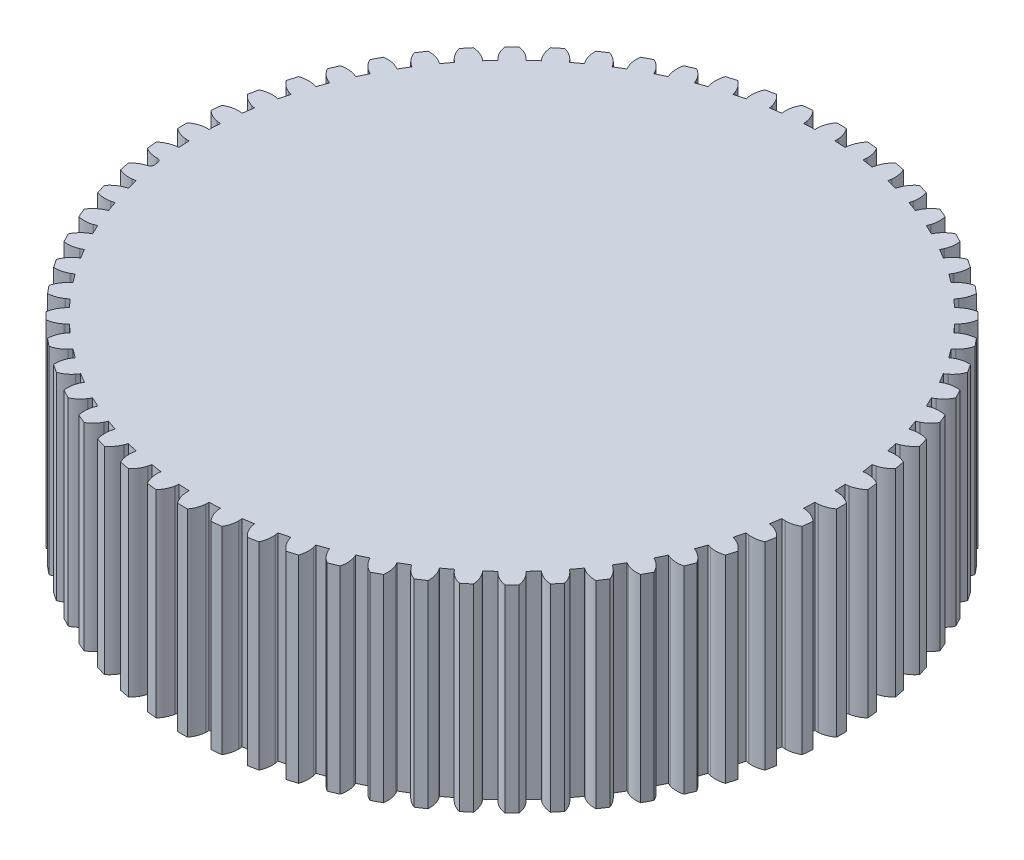
from build123d import *

# Parameters (mm, degrees)
SKETCH2_R           = 47.5
BOSS_EXTRUDE1_DEPTH = 30
BOSS_EXTRUDE2_DEPTH = 30


with BuildPart() as part:
    # Sketch2 → Boss-Extrude1 (new body)
    with BuildSketch(Plane(origin=(0, 0, 0), x_dir=(1, 0, 0), z_dir=(0, 1, 0))):
        Circle(SKETCH2_R)
    extrude(amount=BOSS_EXTRUDE1_DEPTH)

    # Sketch3 → Boss-Extrude2 (add)
    with BuildSketch(Plane(origin=(0, 30, 0), x_dir=(1, 0, 0), z_dir=(0, 1, 0))):
        with BuildLine():
            ThreePointArc((-1.507440184, 47.476074228), (0, 47.5), (1.507440184, 47.476074228))
            ThreePointArc((1.507440184, 47.476074228), (1.514413482, 47.721045398), (1.505602789, 47.965957367))
            ThreePointArc((1.505602789, 47.965957367), (1.501707512, 48.00187307), (1.5, 48.037959013))
            ThreePointArc((1.5, 48.037959013), (1.262315389, 49.068807268), (0.75, 49.994374684))
            Line((0.75, 49.994374684), (-0.75, 49.994374684))
            ThreePointArc((-0.75, 49.994374684), (-1.262315389, 49.068807268), (-1.5, 48.037959013))
            ThreePointArc((-1.5, 48.037959013), (-1.501707512, 48.00187307), (-1.505602789, 47.965957367))
            ThreePointArc((-1.505602789, 47.965957367), (-1.514413482, 47.721045398), (-1.507440184, 47.476074228))
        make_face()
        with BuildLine():
            ThreePointArc((-3.21576628, 47.953668821), (-3.553347172, 48.956256094), (-4.153917094, 49.82715096))
            Line((-4.153917094, 49.82715096), (-5.646694184, 49.680125249))
            ThreePointArc((-5.646694184, 49.680125249), (-6.065821164, 48.708799004), (-6.20132046, 47.6596174))
            ThreePointArc((-6.20132046, 47.6596174), (-6.199482709, 47.623537855), (-6.199838874, 47.587413292))
            ThreePointArc((-6.199838874, 47.587413292), (-6.184601571, 47.342817042), (-6.153650477, 47.099708978))
            ThreePointArc((-6.153650477, 47.099708978), (-4.655814166, 47.271274517), (-3.153287582, 47.39521893))
            ThreePointArc((-3.153287582, 47.39521893), (-3.170359236, 47.639694), (-3.203133074, 47.882563052))
            ThreePointArc((-3.203133074, 47.882563052), (-3.210529949, 47.917924007), (-3.21576628, 47.953668821))
        make_face()
        with BuildLine():
            Line((5.646694184, 49.680125249), (4.153917094, 49.82715096))
            ThreePointArc((4.153917094, 49.82715096), (3.553347172, 48.956256094), (3.21576628, 47.953668821))
            ThreePointArc((3.21576628, 47.953668821), (3.210529949, 47.917924007), (3.203133074, 47.882563052))
            ThreePointArc((3.203133074, 47.882563052), (3.170359236, 47.639694), (3.153287582, 47.39521893))
            ThreePointArc((3.153287582, 47.39521893), (4.655814166, 47.271274517), (6.153650477, 47.099708978))
            ThreePointArc((6.153650477, 47.099708978), (6.184601571, 47.342817042), (6.199838874, 47.587413292))
            ThreePointArc((6.199838874, 47.587413292), (6.199482709, 47.623537855), (6.20132046, 47.6596174))
            ThreePointArc((6.20132046, 47.6596174), (6.065821164, 48.708799004), (5.646694184, 49.680125249))
        make_face()
        with BuildLine():
            ThreePointArc((-7.900562972, 47.407558583), (-8.334789058, 48.372229411), (-9.017829696, 49.180064534))
            Line((-9.017829696, 49.180064534), (-10.489007616, 48.887429051))
            ThreePointArc((-10.489007616, 48.887429051), (-10.810909764, 47.879698379), (-10.842918813, 46.822287617))
            ThreePointArc((-10.842918813, 46.822287617), (-10.837553498, 46.786561936), (-10.834367122, 46.750576413))
            ThreePointArc((-10.834367122, 46.750576413), (-10.795228566, 46.508651478), (-10.740597753, 46.269747783))
            ThreePointArc((-10.740597753, 46.269747783), (-9.266790296, 46.587300819), (-7.783647466, 46.857921765))
            ThreePointArc((-7.783647466, 46.857921765), (-7.824599662, 47.099546306), (-7.881021015, 47.338033479))
            ThreePointArc((-7.881021015, 47.338033479), (-7.891848251, 47.372499141), (-7.900562972, 47.407558583))
        make_face()
        with BuildLine():
            Line((10.489007616, 48.887429051), (9.017829696, 49.180064534))
            ThreePointArc((9.017829696, 49.180064534), (8.334789058, 48.372229411), (7.900562972, 47.407558583))
            ThreePointArc((7.900562972, 47.407558583), (7.891848251, 47.372499141), (7.881021015, 47.338033479))
            ThreePointArc((7.881021015, 47.338033479), (7.824599662, 47.099546306), (7.783647466, 46.857921765))
            ThreePointArc((7.783647466, 46.857921765), (9.266790296, 46.587300819), (10.740597753, 46.269747783))
            ThreePointArc((10.740597753, 46.269747783), (10.795228566, 46.508651478), (10.834367122, 46.750576413))
            ThreePointArc((10.834367122, 46.750576413), (10.837553498, 46.786561936), (10.842918813, 46.822287617))
            ThreePointArc((10.842918813, 46.822287617), (10.810909764, 47.879698379), (10.489007616, 48.887429051))
        make_face()
        with BuildLine():
            ThreePointArc((-12.509272924, 46.404887641), (-13.035962369, 47.322351716), (-13.794895668, 48.059347202))
            Line((-13.794895668, 48.059347202), (-15.230306171, 47.623920186))
            ThreePointArc((-15.230306171, 47.623920186), (-15.451883394, 46.589490086), (-15.380093932, 45.53403361))
            ThreePointArc((-15.380093932, 45.53403361), (-15.371252722, 45.499005851), (-15.364554492, 45.463505927))
            ThreePointArc((-15.364554492, 45.463505927), (-15.301891608, 45.226582175), (-15.2241072, 44.994183624))
            ThreePointArc((-15.2241072, 44.994183624), (-13.78852217, 45.454665947), (-12.339046569, 45.869357198))
            ThreePointArc((-12.339046569, 45.869357198), (-12.403484915, 46.105804233), (-12.483010415, 46.337612766))
            ThreePointArc((-12.483010415, 46.337612766), (-12.497163741, 46.370851212), (-12.509272924, 46.404887641))
        make_face()
        with BuildLine():
            Line((15.230306171, 47.623920186), (13.794895668, 48.059347202))
            ThreePointArc((13.794895668, 48.059347202), (13.035962369, 47.322351716), (12.509272924, 46.404887641))
            ThreePointArc((12.509272924, 46.404887641), (12.497163741, 46.370851212), (12.483010415, 46.337612766))
            ThreePointArc((12.483010415, 46.337612766), (12.403484915, 46.105804233), (12.339046569, 45.869357198))
            ThreePointArc((12.339046569, 45.869357198), (13.78852217, 45.454665947), (15.2241072, 44.994183624))
            ThreePointArc((15.2241072, 44.994183624), (15.301891608, 45.226582175), (15.364554492, 45.463505927))
            ThreePointArc((15.364554492, 45.463505927), (15.371252722, 45.499005851), (15.380093932, 45.53403361))
            ThreePointArc((15.380093932, 45.53403361), (15.451883394, 46.589490086), (15.230306171, 47.623920186))
        make_face()
        with BuildLine():
            ThreePointArc((-16.99751174, 44.955312264), (-17.611592236, 45.816733905), (-18.439109253, 46.475792085))
            Line((-18.439109253, 46.475792085), (-19.824928552, 45.901766937))
            ThreePointArc((-19.824928552, 45.901766937), (-19.944046939, 44.850599534), (-19.769150338, 43.807261967))
            ThreePointArc((-19.769150338, 43.807261967), (-19.756918381, 43.773269466), (-19.746772803, 43.738597026))
            ThreePointArc((-19.746772803, 43.738597026), (-19.661189069, 43.508956164), (-19.561000173, 43.285300879))
            ThreePointArc((-19.561000173, 43.285300879), (-18.177463037, 43.884277794), (-16.775613908, 44.439045647))
            ThreePointArc((-16.775613908, 44.439045647), (-16.862917829, 44.668038063), (-16.964781601, 44.890935512))
            ThreePointArc((-16.964781601, 44.890935512), (-16.982124712, 44.922626636), (-16.99751174, 44.955312264))
        make_face()
        with BuildLine():
            Line((19.824928552, 45.901766937), (18.439109253, 46.475792085))
            ThreePointArc((18.439109253, 46.475792085), (17.611592236, 45.816733905), (16.99751174, 44.955312264))
            ThreePointArc((16.99751174, 44.955312264), (16.982124712, 44.922626636), (16.964781601, 44.890935512))
            ThreePointArc((16.964781601, 44.890935512), (16.862917829, 44.668038063), (16.775613908, 44.439045647))
            ThreePointArc((16.775613908, 44.439045647), (18.177463037, 43.884277794), (19.561000173, 43.285300879))
            ThreePointArc((19.561000173, 43.285300879), (19.661189069, 43.508956164), (19.746772803, 43.738597026))
            ThreePointArc((19.746772803, 43.738597026), (19.756918381, 43.773269466), (19.769150338, 43.807261967))
            ThreePointArc((19.769150338, 43.807261967), (19.944046939, 44.850599534), (19.824928552, 45.901766937))
        make_face()
        with BuildLine():
            ThreePointArc((-21.322055226, 43.072792655), (-22.017612842, 43.869875901), (-22.905744137, 44.444649684))
            Line((-22.905744137, 44.444649684), (-24.228626034, 43.737554579))
            ThreePointArc((-24.228626034, 43.737554579), (-24.24413841, 42.67977319), (-23.967819019, 41.658602444))
            ThreePointArc((-23.967819019, 41.658602444), (-23.952314114, 41.625972568), (-23.938818897, 41.592461525))
            ThreePointArc((-23.938818897, 41.592461525), (-23.831138532, 41.372315119), (-23.709510021, 41.159557026))
            ThreePointArc((-23.709510021, 41.159557026), (-22.391344999, 41.891260057), (-21.050622915, 42.580761793))
            ThreePointArc((-21.050622915, 42.580761793), (-21.159951625, 42.800094267), (-21.283172666, 43.011934008))
            ThreePointArc((-21.283172666, 43.011934008), (-21.303538539, 43.04177261), (-21.322055226, 43.072792655))
        make_face()
        with BuildLine():
            Line((24.228626034, 43.737554579), (22.905744137, 44.444649684))
            ThreePointArc((22.905744137, 44.444649684), (22.017612842, 43.869875901), (21.322055226, 43.072792655))
            ThreePointArc((21.322055226, 43.072792655), (21.303538539, 43.04177261), (21.283172666, 43.011934008))
            ThreePointArc((21.283172666, 43.011934008), (21.159951625, 42.800094267), (21.050622915, 42.580761793))
            ThreePointArc((21.050622915, 42.580761793), (22.391344999, 41.891260057), (23.709510021, 41.159557026))
            ThreePointArc((23.709510021, 41.159557026), (23.831138532, 41.372315119), (23.938818897, 41.592461525))
            ThreePointArc((23.938818897, 41.592461525), (23.952314114, 41.625972568), (23.967819019, 41.658602444))
            ThreePointArc((23.967819019, 41.658602444), (24.24413841, 42.67977319), (24.228626034, 43.737554579))
        make_face()
        with BuildLine():
            ThreePointArc((-25.441255664, 40.775458506), (-26.2115918, 41.50052701), (-27.151784183, 41.98548101))
            Line((-27.151784183, 41.98548101), (-28.398988602, 41.152125661))
            ThreePointArc((-28.398988602, 41.152125661), (-28.310745575, 40.0979173), (-27.935664501, 39.108747807))
            ThreePointArc((-27.935664501, 39.108747807), (-27.91703597, 39.077794799), (-27.900321079, 39.045767883))
            ThreePointArc((-27.900321079, 39.045767883), (-27.771581103, 38.837236064), (-27.629684327, 38.637424138))
            ThreePointArc((-27.629684327, 38.637424138), (-26.389586068, 39.494806584), (-25.122902916, 40.312401926))
            ThreePointArc((-25.122902916, 40.312401926), (-25.25320352, 40.519962167), (-25.396595144, 40.718704068))
            ThreePointArc((-25.396595144, 40.718704068), (-25.419787644, 40.746402784), (-25.441255664, 40.775458506))
        make_face()
        with BuildLine():
            Line((28.398988602, 41.152125661), (27.151784183, 41.98548101))
            ThreePointArc((27.151784183, 41.98548101), (26.2115918, 41.50052701), (25.441255664, 40.775458506))
            ThreePointArc((25.441255664, 40.775458506), (25.419787644, 40.746402784), (25.396595144, 40.718704068))
            ThreePointArc((25.396595144, 40.718704068), (25.25320352, 40.519962167), (25.122902916, 40.312401926))
            ThreePointArc((25.122902916, 40.312401926), (26.389586068, 39.494806584), (27.629684327, 38.637424138))
            ThreePointArc((27.629684327, 38.637424138), (27.771581103, 38.837236064), (27.900321079, 39.045767883))
            ThreePointArc((27.900321079, 39.045767883), (27.91703597, 39.077794799), (27.935664501, 39.108747807))
            ThreePointArc((27.935664501, 39.108747807), (28.310745575, 40.0979173), (28.398988602, 41.152125661))
        make_face()
        with BuildLine():
            ThreePointArc((-29.315442903, 38.085434401), (-30.153138801, 38.731505358), (-31.136337705, 39.121969203))
            Line((-31.136337705, 39.121969203), (-32.295853385, 38.170379277))
            ThreePointArc((-32.295853385, 38.170379277), (-32.104704784, 37.129896547), (-31.634474263, 36.182254549))
            ThreePointArc((-31.634474263, 36.182254549), (-31.612901507, 36.153276503), (-31.593127916, 36.123042152))
            ThreePointArc((-31.593127916, 36.123042152), (-31.444568166, 35.928133195), (-31.283769669, 35.743191734))
            ThreePointArc((-31.283769669, 35.743191734), (-30.133680998, 36.717996535), (-28.953235629, 37.655811592))
            ThreePointArc((-28.953235629, 37.655811592), (-29.103253261, 37.849600681), (-29.265434528, 38.033330748))
            ThreePointArc((-29.265434528, 38.033330748), (-29.291230298, 38.058622824), (-29.315442903, 38.085434401))
        make_face()
        with BuildLine():
            Line((32.295853385, 38.170379277), (31.136337705, 39.121969203))
            ThreePointArc((31.136337705, 39.121969203), (30.153138801, 38.731505358), (29.315442903, 38.085434401))
            ThreePointArc((29.315442903, 38.085434401), (29.291230298, 38.058622824), (29.265434528, 38.033330748))
            ThreePointArc((29.265434528, 38.033330748), (29.103253261, 37.849600681), (28.953235629, 37.655811592))
            ThreePointArc((28.953235629, 37.655811592), (30.133680998, 36.717996535), (31.283769669, 35.743191734))
            ThreePointArc((31.283769669, 35.743191734), (31.444568166, 35.928133195), (31.593127917, 36.123042152))
            ThreePointArc((31.593127917, 36.123042152), (31.612901507, 36.153276503), (31.634474263, 36.182254549))
            ThreePointArc((31.634474263, 36.182254549), (32.104704784, 37.129896547), (32.295853385, 38.170379277))
        make_face()
        with BuildLine():
            ThreePointArc((-32.907306401, 35.028626744), (-33.804294592, 35.589478136), (-34.821031274, 35.881691446))
            Line((-34.821031274, 35.881691446), (-35.881691446, 34.821031274))
            ThreePointArc((-35.881691446, 34.821031274), (-35.589478136, 33.804294592), (-35.028626744, 32.907306401))
            ThreePointArc((-35.028626744, 32.907306401), (-35.004317522, 32.880582392), (-34.981675662, 32.852431778))
            ThreePointArc((-34.981675662, 32.852431778), (-34.814726849, 32.673022763), (-34.636575207, 32.504732854))
            ThreePointArc((-34.636575207, 32.504732854), (-33.587572106, 33.587572106), (-32.504732854, 34.636575207))
            ThreePointArc((-32.504732854, 34.636575207), (-32.673022763, 34.814726849), (-32.852431778, 34.981675662))
            ThreePointArc((-32.852431778, 34.981675662), (-32.880582392, 35.004317522), (-32.907306401, 35.028626744))
        make_face()
        with BuildLine():
            Line((35.881691446, 34.821031274), (34.821031274, 35.881691446))
            ThreePointArc((34.821031274, 35.881691446), (33.804294592, 35.589478136), (32.907306401, 35.028626744))
            ThreePointArc((32.907306401, 35.028626744), (32.880582392, 35.004317522), (32.852431778, 34.981675662))
            ThreePointArc((32.852431778, 34.981675662), (32.673022763, 34.814726849), (32.504732854, 34.636575207))
            ThreePointArc((32.504732854, 34.636575207), (33.587572106, 33.587572106), (34.636575207, 32.504732854))
            ThreePointArc((34.636575207, 32.504732854), (34.814726849, 32.673022763), (34.981675662, 32.852431778))
            ThreePointArc((34.981675662, 32.852431778), (35.004317522, 32.880582392), (35.028626744, 32.907306401))
            ThreePointArc((35.028626744, 32.907306401), (35.589478136, 33.804294592), (35.881691446, 34.821031274))
        make_face()
        with BuildLine():
            ThreePointArc((-36.182254549, 31.634474263), (-37.129896547, 32.104704784), (-38.170379277, 32.295853385))
            Line((-38.170379277, 32.295853385), (-39.121969203, 31.136337705))
            ThreePointArc((-39.121969203, 31.136337705), (-38.731505358, 30.153138801), (-38.085434401, 29.315442903))
            ThreePointArc((-38.085434401, 29.315442903), (-38.058622824, 29.291230298), (-38.033330748, 29.265434528))
            ThreePointArc((-38.033330748, 29.265434528), (-37.849600681, 29.103253261), (-37.655811592, 28.953235629))
            ThreePointArc((-37.655811592, 28.953235629), (-36.717996535, 30.133680998), (-35.743191734, 31.283769669))
            ThreePointArc((-35.743191734, 31.283769669), (-35.928133195, 31.444568166), (-36.123042152, 31.593127916))
            ThreePointArc((-36.123042152, 31.593127916), (-36.153276503, 31.612901507), (-36.182254549, 31.634474263))
        make_face()
        with BuildLine():
            Line((39.121969203, 31.136337705), (38.170379277, 32.295853385))
            ThreePointArc((38.170379277, 32.295853385), (37.129896547, 32.104704784), (36.182254549, 31.634474263))
            ThreePointArc((36.182254549, 31.634474263), (36.153276503, 31.612901507), (36.123042152, 31.593127917))
            ThreePointArc((36.123042152, 31.593127917), (35.928133195, 31.444568166), (35.743191734, 31.283769669))
            ThreePointArc((35.743191734, 31.283769669), (36.717996535, 30.133680998), (37.655811592, 28.953235629))
            ThreePointArc((37.655811592, 28.953235629), (37.849600681, 29.103253261), (38.033330748, 29.265434528))
            ThreePointArc((38.033330748, 29.265434528), (38.058622824, 29.291230298), (38.085434401, 29.315442903))
            ThreePointArc((38.085434401, 29.315442903), (38.731505358, 30.153138801), (39.121969203, 31.136337705))
        make_face()
        with BuildLine():
            ThreePointArc((-39.108747807, 27.935664501), (-40.0979173, 28.310745575), (-41.152125661, 28.398988602))
            Line((-41.152125661, 28.398988602), (-41.98548101, 27.151784183))
            ThreePointArc((-41.98548101, 27.151784183), (-41.50052701, 26.2115918), (-40.775458506, 25.441255664))
            ThreePointArc((-40.775458506, 25.441255664), (-40.746402784, 25.419787644), (-40.718704068, 25.396595144))
            ThreePointArc((-40.718704068, 25.396595144), (-40.519962167, 25.25320352), (-40.312401926, 25.122902916))
            ThreePointArc((-40.312401926, 25.122902916), (-39.494806584, 26.389586068), (-38.637424138, 27.629684327))
            ThreePointArc((-38.637424138, 27.629684327), (-38.837236064, 27.771581103), (-39.045767883, 27.900321079))
            ThreePointArc((-39.045767883, 27.900321079), (-39.077794799, 27.91703597), (-39.108747807, 27.935664501))
        make_face()
        with BuildLine():
            Line((41.98548101, 27.151784183), (41.152125661, 28.398988602))
            ThreePointArc((41.152125661, 28.398988602), (40.0979173, 28.310745575), (39.108747807, 27.935664501))
            ThreePointArc((39.108747807, 27.935664501), (39.077794799, 27.91703597), (39.045767883, 27.900321079))
            ThreePointArc((39.045767883, 27.900321079), (38.837236064, 27.771581103), (38.637424138, 27.629684327))
            ThreePointArc((38.637424138, 27.629684327), (39.494806584, 26.389586068), (40.312401926, 25.122902916))
            ThreePointArc((40.312401926, 25.122902916), (40.519962167, 25.253203521), (40.718704068, 25.396595144))
            ThreePointArc((40.718704068, 25.396595144), (40.746402784, 25.419787644), (40.775458506, 25.441255664))
            ThreePointArc((40.775458506, 25.441255664), (41.50052701, 26.2115918), (41.98548101, 27.151784183))
        make_face()
        with BuildLine():
            ThreePointArc((-41.658602444, 23.967819019), (-42.67977319, 24.24413841), (-43.737554579, 24.228626034))
            Line((-43.737554579, 24.228626034), (-44.444649684, 22.905744137))
            ThreePointArc((-44.444649684, 22.905744137), (-43.869875901, 22.017612842), (-43.072792655, 21.322055226))
            ThreePointArc((-43.072792655, 21.322055226), (-43.04177261, 21.303538539), (-43.011934008, 21.283172666))
            ThreePointArc((-43.011934008, 21.283172666), (-42.800094267, 21.159951625), (-42.580761793, 21.050622915))
            ThreePointArc((-42.580761793, 21.050622915), (-41.891260057, 22.391344999), (-41.159557026, 23.709510021))
            ThreePointArc((-41.159557026, 23.709510021), (-41.372315119, 23.831138532), (-41.592461525, 23.938818897))
            ThreePointArc((-41.592461525, 23.938818897), (-41.625972568, 23.952314114), (-41.658602444, 23.967819019))
        make_face()
        with BuildLine():
            Line((44.444649684, 22.905744137), (43.737554579, 24.228626034))
            ThreePointArc((43.737554579, 24.228626034), (42.67977319, 24.24413841), (41.658602444, 23.967819019))
            ThreePointArc((41.658602444, 23.967819019), (41.625972568, 23.952314114), (41.592461525, 23.938818897))
            ThreePointArc((41.592461525, 23.938818897), (41.372315119, 23.831138532), (41.159557026, 23.709510021))
            ThreePointArc((41.159557026, 23.709510021), (41.891260057, 22.391344999), (42.580761793, 21.050622915))
            ThreePointArc((42.580761793, 21.050622915), (42.800094267, 21.159951625), (43.011934008, 21.283172666))
            ThreePointArc((43.011934008, 21.283172666), (43.04177261, 21.303538539), (43.072792655, 21.322055226))
            ThreePointArc((43.072792655, 21.322055226), (43.869875901, 22.017612842), (44.444649684, 22.905744137))
        make_face()
        with BuildLine():
            ThreePointArc((-43.807261967, 19.769150338), (-44.850599534, 19.944046939), (-45.901766937, 19.824928552))
            Line((-45.901766937, 19.824928552), (-46.475792085, 18.439109253))
            ThreePointArc((-46.475792085, 18.439109253), (-45.816733905, 17.611592236), (-44.955312264, 16.99751174))
            ThreePointArc((-44.955312264, 16.99751174), (-44.922626636, 16.982124712), (-44.890935512, 16.964781601))
            ThreePointArc((-44.890935512, 16.964781601), (-44.668038063, 16.862917829), (-44.439045647, 16.775613908))
            ThreePointArc((-44.439045647, 16.775613908), (-43.884277794, 18.177463037), (-43.285300879, 19.561000173))
            ThreePointArc((-43.285300879, 19.561000173), (-43.508956164, 19.661189069), (-43.738597026, 19.746772803))
            ThreePointArc((-43.738597026, 19.746772803), (-43.773269466, 19.756918381), (-43.807261967, 19.769150338))
        make_face()
        with BuildLine():
            Line((46.475792085, 18.439109253), (45.901766937, 19.824928552))
            ThreePointArc((45.901766937, 19.824928552), (44.850599534, 19.944046939), (43.807261967, 19.769150338))
            ThreePointArc((43.807261967, 19.769150338), (43.773269466, 19.756918381), (43.738597026, 19.746772803))
            ThreePointArc((43.738597026, 19.746772803), (43.508956164, 19.661189069), (43.285300879, 19.561000173))
            ThreePointArc((43.285300879, 19.561000173), (43.884277794, 18.177463037), (44.439045647, 16.775613908))
            ThreePointArc((44.439045647, 16.775613908), (44.668038063, 16.862917829), (44.890935512, 16.964781601))
            ThreePointArc((44.890935512, 16.964781601), (44.922626636, 16.982124712), (44.955312264, 16.99751174))
            ThreePointArc((44.955312264, 16.99751174), (45.816733905, 17.611592236), (46.475792085, 18.439109253))
        make_face()
        with BuildLine():
            ThreePointArc((-45.53403361, 15.380093932), (-46.589490086, 15.451883393), (-47.623920186, 15.230306171))
            Line((-47.623920186, 15.230306171), (-48.059347202, 13.794895668))
            ThreePointArc((-48.059347202, 13.794895668), (-47.322351716, 13.035962369), (-46.404887641, 12.509272924))
            ThreePointArc((-46.404887641, 12.509272924), (-46.370851212, 12.497163741), (-46.337612766, 12.483010415))
            ThreePointArc((-46.337612766, 12.483010415), (-46.105804233, 12.403484915), (-45.869357198, 12.339046569))
            ThreePointArc((-45.869357198, 12.339046569), (-45.454665947, 13.78852217), (-44.994183624, 15.2241072))
            ThreePointArc((-44.994183624, 15.2241072), (-45.226582175, 15.301891608), (-45.463505927, 15.364554492))
            ThreePointArc((-45.463505927, 15.364554492), (-45.499005851, 15.371252722), (-45.53403361, 15.380093932))
        make_face()
        with BuildLine():
            Line((48.059347202, 13.794895668), (47.623920186, 15.230306171))
            ThreePointArc((47.623920186, 15.230306171), (46.589490086, 15.451883394), (45.53403361, 15.380093932))
            ThreePointArc((45.53403361, 15.380093932), (45.499005851, 15.371252722), (45.463505927, 15.364554492))
            ThreePointArc((45.463505927, 15.364554492), (45.226582175, 15.301891608), (44.994183624, 15.2241072))
            ThreePointArc((44.994183624, 15.2241072), (45.454665947, 13.78852217), (45.869357198, 12.339046569))
            ThreePointArc((45.869357198, 12.339046569), (46.105804233, 12.403484915), (46.337612766, 12.483010415))
            ThreePointArc((46.337612766, 12.483010415), (46.370851212, 12.497163741), (46.404887641, 12.509272924))
            ThreePointArc((46.404887641, 12.509272924), (47.322351716, 13.035962369), (48.059347202, 13.794895668))
        make_face()
        with BuildLine():
            ThreePointArc((-46.822287617, 10.842918813), (-47.879698379, 10.810909764), (-48.887429051, 10.489007616))
            Line((-48.887429051, 10.489007616), (-49.180064534, 9.017829696))
            ThreePointArc((-49.180064534, 9.017829696), (-48.372229411, 8.334789058), (-47.407558583, 7.900562972))
            ThreePointArc((-47.407558583, 7.900562972), (-47.372499141, 7.891848251), (-47.338033479, 7.881021015))
            ThreePointArc((-47.338033479, 7.881021015), (-47.099546306, 7.824599662), (-46.857921765, 7.783647466))
            ThreePointArc((-46.857921765, 7.783647466), (-46.587300819, 9.266790296), (-46.269747783, 10.740597753))
            ThreePointArc((-46.269747783, 10.740597753), (-46.508651478, 10.795228566), (-46.750576413, 10.834367122))
            ThreePointArc((-46.750576413, 10.834367122), (-46.786561936, 10.837553498), (-46.822287617, 10.842918813))
        make_face()
        with BuildLine():
            Line((49.180064534, 9.017829696), (48.887429051, 10.489007616))
            ThreePointArc((48.887429051, 10.489007616), (47.879698379, 10.810909764), (46.822287617, 10.842918813))
            ThreePointArc((46.822287617, 10.842918813), (46.786561936, 10.837553498), (46.750576413, 10.834367122))
            ThreePointArc((46.750576413, 10.834367122), (46.508651478, 10.795228566), (46.269747783, 10.740597753))
            ThreePointArc((46.269747783, 10.740597753), (46.587300819, 9.266790296), (46.857921765, 7.783647466))
            ThreePointArc((46.857921765, 7.783647466), (47.099546306, 7.824599662), (47.338033479, 7.881021015))
            ThreePointArc((47.338033479, 7.881021015), (47.372499141, 7.891848251), (47.407558583, 7.900562972))
            ThreePointArc((47.407558583, 7.900562972), (48.372229411, 8.334789058), (49.180064534, 9.017829696))
        make_face()
        with BuildLine():
            ThreePointArc((-47.6596174, 6.20132046), (-48.708799004, 6.065821163), (-49.680125249, 5.646694184))
            Line((-49.680125249, 5.646694184), (-49.82715096, 4.153917094))
            ThreePointArc((-49.82715096, 4.153917094), (-48.956256094, 3.553347172), (-47.953668821, 3.21576628))
            ThreePointArc((-47.953668821, 3.21576628), (-47.917924007, 3.210529949), (-47.882563052, 3.203133074))
            ThreePointArc((-47.882563052, 3.203133074), (-47.639694, 3.170359236), (-47.39521893, 3.153287582))
            ThreePointArc((-47.39521893, 3.153287582), (-47.271274517, 4.655814166), (-47.099708978, 6.153650477))
            ThreePointArc((-47.099708978, 6.153650477), (-47.342817042, 6.184601571), (-47.587413292, 6.199838874))
            ThreePointArc((-47.587413292, 6.199838874), (-47.623537855, 6.199482709), (-47.6596174, 6.20132046))
        make_face()
        with BuildLine():
            Line((49.82715096, 4.153917094), (49.680125249, 5.646694184))
            ThreePointArc((49.680125249, 5.646694184), (48.708799004, 6.065821164), (47.6596174, 6.20132046))
            ThreePointArc((47.6596174, 6.20132046), (47.623537855, 6.199482709), (47.587413292, 6.199838874))
            ThreePointArc((47.587413292, 6.199838874), (47.342817042, 6.184601571), (47.099708978, 6.153650477))
            ThreePointArc((47.099708978, 6.153650477), (47.271274517, 4.655814166), (47.39521893, 3.153287582))
            ThreePointArc((47.39521893, 3.153287582), (47.639694, 3.170359236), (47.882563052, 3.203133074))
            ThreePointArc((47.882563052, 3.203133074), (47.917924007, 3.210529949), (47.953668821, 3.21576628))
            ThreePointArc((47.953668821, 3.21576628), (48.956256094, 3.553347172), (49.82715096, 4.153917094))
        make_face()
        with BuildLine():
            ThreePointArc((-48.037959013, 1.5), (-49.068807268, 1.262315389), (-49.994374684, 0.75))
            Line((-49.994374684, 0.75), (-49.994374684, -0.75))
            ThreePointArc((-49.994374684, -0.75), (-49.068807268, -1.262315389), (-48.037959013, -1.5))
            ThreePointArc((-48.037959013, -1.5), (-48.00187307, -1.501707512), (-47.965957367, -1.505602789))
            ThreePointArc((-47.965957367, -1.505602789), (-47.721045398, -1.514413482), (-47.476074228, -1.507440184))
            ThreePointArc((-47.476074228, -1.507440184), (-47.5, 0), (-47.476074228, 1.507440184))
            ThreePointArc((-47.476074228, 1.507440184), (-47.721045398, 1.514413482), (-47.965957367, 1.505602789))
            ThreePointArc((-47.965957367, 1.505602789), (-48.00187307, 1.501707512), (-48.037959013, 1.5))
        make_face()
        with BuildLine():
            Line((49.994374684, -0.75), (49.994374684, 0.75))
            ThreePointArc((49.994374684, 0.75), (49.068807268, 1.262315389), (48.037959013, 1.5))
            ThreePointArc((48.037959013, 1.5), (48.00187307, 1.501707512), (47.965957367, 1.505602789))
            ThreePointArc((47.965957367, 1.505602789), (47.721045398, 1.514413482), (47.476074228, 1.507440184))
            ThreePointArc((47.476074228, 1.507440184), (47.5, 0), (47.476074228, -1.507440184))
            ThreePointArc((47.476074228, -1.507440184), (47.721045398, -1.514413482), (47.965957367, -1.505602789))
            ThreePointArc((47.965957367, -1.505602789), (48.00187307, -1.501707512), (48.037959013, -1.5))
            ThreePointArc((48.037959013, -1.5), (49.068807268, -1.262315389), (49.994374684, -0.75))
        make_face()
        with BuildLine():
            ThreePointArc((-47.953668821, -3.21576628), (-48.956256094, -3.553347172), (-49.82715096, -4.153917094))
            Line((-49.82715096, -4.153917094), (-49.680125249, -5.646694184))
            ThreePointArc((-49.680125249, -5.646694184), (-48.708799004, -6.065821164), (-47.6596174, -6.20132046))
            ThreePointArc((-47.6596174, -6.20132046), (-47.254411705, -6.318363112), (-47.028703307, -6.674658435))
            ThreePointArc((-47.028703307, -6.674658435), (-47.244780514, -4.917388957), (-47.39521893, -3.153287582))
            ThreePointArc((-47.39521893, -3.153287582), (-47.639694, -3.170359236), (-47.882563052, -3.203133074))
            ThreePointArc((-47.882563052, -3.203133074), (-47.917924007, -3.210529949), (-47.953668821, -3.21576628))
        make_face()
        with BuildLine():
            Line((49.680125249, -5.646694184), (49.82715096, -4.153917094))
            ThreePointArc((49.82715096, -4.153917094), (48.956256094, -3.553347172), (47.953668821, -3.21576628))
            ThreePointArc((47.953668821, -3.21576628), (47.917924007, -3.210529949), (47.882563052, -3.203133074))
            ThreePointArc((47.882563052, -3.203133074), (47.639694, -3.170359236), (47.39521893, -3.153287582))
            ThreePointArc((47.39521893, -3.153287582), (47.271274517, -4.655814166), (47.099708978, -6.153650477))
            ThreePointArc((47.099708978, -6.153650477), (47.342817042, -6.184601571), (47.587413292, -6.199838874))
            ThreePointArc((47.587413292, -6.199838874), (47.623537855, -6.199482709), (47.6596174, -6.20132046))
            ThreePointArc((47.6596174, -6.20132046), (48.708799004, -6.065821163), (49.680125249, -5.646694184))
        make_face()
        with BuildLine():
            ThreePointArc((-47.407558583, -7.900562972), (-48.372229411, -8.334789058), (-49.180064534, -9.017829696))
            Line((-49.180064534, -9.017829696), (-48.887429051, -10.489007616))
            ThreePointArc((-48.887429051, -10.489007616), (-47.879698379, -10.810909764), (-46.822287617, -10.842918813))
            ThreePointArc((-46.822287617, -10.842918813), (-46.786561936, -10.837553498), (-46.750576413, -10.834367122))
            ThreePointArc((-46.750576413, -10.834367122), (-46.508651478, -10.795228566), (-46.269747783, -10.740597753))
            ThreePointArc((-46.269747783, -10.740597753), (-46.637878793, -9.008788024), (-46.941214202, -7.264462078))
            ThreePointArc((-46.941214202, -7.264462078), (-47.053776599, -7.670935133), (-47.407558583, -7.900562972))
        make_face()
        with BuildLine():
            Line((48.887429051, -10.489007616), (49.180064534, -9.017829696))
            ThreePointArc((49.180064534, -9.017829696), (48.372229411, -8.334789058), (47.407558583, -7.900562972))
            ThreePointArc((47.407558583, -7.900562972), (47.372499141, -7.891848251), (47.338033479, -7.881021015))
            ThreePointArc((47.338033479, -7.881021015), (47.099546306, -7.824599662), (46.857921765, -7.783647466))
            ThreePointArc((46.857921765, -7.783647466), (46.587300819, -9.266790296), (46.269747783, -10.740597753))
            ThreePointArc((46.269747783, -10.740597753), (46.508651478, -10.795228566), (46.750576413, -10.834367122))
            ThreePointArc((46.750576413, -10.834367122), (46.786561936, -10.837553498), (46.822287617, -10.842918813))
            ThreePointArc((46.822287617, -10.842918813), (47.879698379, -10.810909764), (48.887429051, -10.489007616))
        make_face()
        with BuildLine():
            ThreePointArc((-46.404887641, -12.509272924), (-47.322351716, -13.035962369), (-48.059347202, -13.794895668))
            Line((-48.059347202, -13.794895668), (-47.623920186, -15.230306171))
            ThreePointArc((-47.623920186, -15.230306171), (-46.589490086, -15.451883394), (-45.53403361, -15.380093932))
            ThreePointArc((-45.53403361, -15.380093932), (-45.499005851, -15.371252722), (-45.463505927, -15.364554492))
            ThreePointArc((-45.463505927, -15.364554492), (-45.226582175, -15.301891608), (-44.994183624, -15.2241072))
            ThreePointArc((-44.994183624, -15.2241072), (-45.454665947, -13.78852217), (-45.869357198, -12.339046569))
            ThreePointArc((-45.869357198, -12.339046569), (-46.105804233, -12.403484915), (-46.337612766, -12.483010415))
            ThreePointArc((-46.337612766, -12.483010415), (-46.370851212, -12.497163741), (-46.404887641, -12.509272924))
        make_face()
        with BuildLine():
            Line((47.623920186, -15.230306171), (48.059347202, -13.794895668))
            ThreePointArc((48.059347202, -13.794895668), (47.322351716, -13.035962369), (46.404887641, -12.509272924))
            ThreePointArc((46.404887641, -12.509272924), (46.370851212, -12.497163741), (46.337612766, -12.483010415))
            ThreePointArc((46.337612766, -12.483010415), (46.105804233, -12.403484915), (45.869357198, -12.339046569))
            ThreePointArc((45.869357198, -12.339046569), (45.454665947, -13.78852217), (44.994183624, -15.2241072))
            ThreePointArc((44.994183624, -15.2241072), (45.226582175, -15.301891608), (45.463505927, -15.364554492))
            ThreePointArc((45.463505927, -15.364554492), (45.499005851, -15.371252722), (45.53403361, -15.380093932))
            ThreePointArc((45.53403361, -15.380093932), (46.589490086, -15.451883393), (47.623920186, -15.230306171))
        make_face()
        with BuildLine():
            ThreePointArc((-44.955312264, -16.99751174), (-45.816733905, -17.611592236), (-46.475792085, -18.439109253))
            Line((-46.475792085, -18.439109253), (-45.901766937, -19.824928552))
            ThreePointArc((-45.901766937, -19.824928552), (-44.850599534, -19.944046939), (-43.807261967, -19.769150338))
            ThreePointArc((-43.807261967, -19.769150338), (-43.773269466, -19.756918381), (-43.738597026, -19.746772803))
            ThreePointArc((-43.738597026, -19.746772803), (-43.508956164, -19.661189069), (-43.285300879, -19.561000173))
            ThreePointArc((-43.285300879, -19.561000173), (-43.884277794, -18.177463037), (-44.439045647, -16.775613908))
            ThreePointArc((-44.439045647, -16.775613908), (-44.668038062, -16.862917829), (-44.890935512, -16.964781601))
            ThreePointArc((-44.890935512, -16.964781601), (-44.922626636, -16.982124712), (-44.955312264, -16.99751174))
        make_face()
        with BuildLine():
            Line((45.901766937, -19.824928552), (46.475792085, -18.439109253))
            ThreePointArc((46.475792085, -18.439109253), (45.816733905, -17.611592236), (44.955312264, -16.99751174))
            ThreePointArc((44.955312264, -16.99751174), (44.922626636, -16.982124712), (44.890935512, -16.964781601))
            ThreePointArc((44.890935512, -16.964781601), (44.668038063, -16.862917829), (44.439045647, -16.775613908))
            ThreePointArc((44.439045647, -16.775613908), (43.884277794, -18.177463037), (43.285300879, -19.561000173))
            ThreePointArc((43.285300879, -19.561000173), (43.508956164, -19.661189069), (43.738597026, -19.746772803))
            ThreePointArc((43.738597026, -19.746772803), (43.773269466, -19.756918381), (43.807261967, -19.769150338))
            ThreePointArc((43.807261967, -19.769150338), (44.850599534, -19.944046939), (45.901766937, -19.824928552))
        make_face()
        with BuildLine():
            ThreePointArc((-43.072792655, -21.322055226), (-43.869875901, -22.017612842), (-44.444649684, -22.905744137))
            Line((-44.444649684, -22.905744137), (-43.737554579, -24.228626034))
            ThreePointArc((-43.737554579, -24.228626034), (-42.67977319, -24.24413841), (-41.658602444, -23.967819019))
            ThreePointArc((-41.658602444, -23.967819019), (-41.625972568, -23.952314114), (-41.592461525, -23.938818897))
            ThreePointArc((-41.592461525, -23.938818897), (-41.372315119, -23.831138532), (-41.159557026, -23.709510021))
            ThreePointArc((-41.159557026, -23.709510021), (-41.891260057, -22.391344999), (-42.580761793, -21.050622915))
            ThreePointArc((-42.580761793, -21.050622915), (-42.800094267, -21.159951625), (-43.011934008, -21.283172666))
            ThreePointArc((-43.011934008, -21.283172666), (-43.04177261, -21.303538539), (-43.072792655, -21.322055226))
        make_face()
        with BuildLine():
            Line((43.737554579, -24.228626034), (44.444649684, -22.905744137))
            ThreePointArc((44.444649684, -22.905744137), (43.869875901, -22.017612842), (43.072792655, -21.322055226))
            ThreePointArc((43.072792655, -21.322055226), (43.04177261, -21.303538539), (43.011934008, -21.283172666))
            ThreePointArc((43.011934008, -21.283172666), (42.800094267, -21.159951625), (42.580761793, -21.050622915))
            ThreePointArc((42.580761793, -21.050622915), (41.891260057, -22.391344999), (41.159557026, -23.709510021))
            ThreePointArc((41.159557026, -23.709510021), (41.372315119, -23.831138532), (41.592461525, -23.938818897))
            ThreePointArc((41.592461525, -23.938818897), (41.625972568, -23.952314114), (41.658602444, -23.967819019))
            ThreePointArc((41.658602444, -23.967819019), (42.67977319, -24.24413841), (43.737554579, -24.228626034))
        make_face()
        with BuildLine():
            ThreePointArc((-40.775458506, -25.441255664), (-41.50052701, -26.2115918), (-41.98548101, -27.151784183))
            Line((-41.98548101, -27.151784183), (-41.152125661, -28.398988602))
            ThreePointArc((-41.152125661, -28.398988602), (-40.0979173, -28.310745575), (-39.108747807, -27.935664501))
            ThreePointArc((-39.108747807, -27.935664501), (-39.077794799, -27.91703597), (-39.045767883, -27.900321079))
            ThreePointArc((-39.045767883, -27.900321079), (-38.837236064, -27.771581103), (-38.637424138, -27.629684327))
            ThreePointArc((-38.637424138, -27.629684327), (-39.494806584, -26.389586068), (-40.312401926, -25.122902916))
            ThreePointArc((-40.312401926, -25.122902916), (-40.519962167, -25.253203521), (-40.718704068, -25.396595144))
            ThreePointArc((-40.718704068, -25.396595144), (-40.746402784, -25.419787644), (-40.775458506, -25.441255664))
        make_face()
        with BuildLine():
            Line((41.152125661, -28.398988602), (41.98548101, -27.151784183))
            ThreePointArc((41.98548101, -27.151784183), (41.50052701, -26.2115918), (40.775458506, -25.441255664))
            ThreePointArc((40.775458506, -25.441255664), (40.746402784, -25.419787644), (40.718704068, -25.396595144))
            ThreePointArc((40.718704068, -25.396595144), (40.519962167, -25.25320352), (40.312401926, -25.122902916))
            ThreePointArc((40.312401926, -25.122902916), (39.494806584, -26.389586068), (38.637424138, -27.629684327))
            ThreePointArc((38.637424138, -27.629684327), (38.837236064, -27.771581103), (39.045767883, -27.900321079))
            ThreePointArc((39.045767883, -27.900321079), (39.077794799, -27.91703597), (39.108747807, -27.935664501))
            ThreePointArc((39.108747807, -27.935664501), (40.0979173, -28.310745575), (41.152125661, -28.398988602))
        make_face()
        with BuildLine():
            ThreePointArc((-38.085434401, -29.315442903), (-38.731505358, -30.153138801), (-39.121969203, -31.136337705))
            Line((-39.121969203, -31.136337705), (-38.170379277, -32.295853385))
            ThreePointArc((-38.170379277, -32.295853385), (-37.129896547, -32.104704784), (-36.182254549, -31.634474263))
            ThreePointArc((-36.182254549, -31.634474263), (-36.153276503, -31.612901507), (-36.123042152, -31.593127917))
            ThreePointArc((-36.123042152, -31.593127917), (-35.928133195, -31.444568166), (-35.743191734, -31.283769669))
            ThreePointArc((-35.743191734, -31.283769669), (-36.717996535, -30.133680998), (-37.655811592, -28.953235629))
            ThreePointArc((-37.655811592, -28.953235629), (-37.849600681, -29.103253261), (-38.033330748, -29.265434528))
            ThreePointArc((-38.033330748, -29.265434528), (-38.058622824, -29.291230298), (-38.085434401, -29.315442903))
        make_face()
        with BuildLine():
            Line((38.170379277, -32.295853385), (39.121969203, -31.136337705))
            ThreePointArc((39.121969203, -31.136337705), (38.731505358, -30.153138801), (38.085434401, -29.315442903))
            ThreePointArc((38.085434401, -29.315442903), (38.058622824, -29.291230298), (38.033330748, -29.265434528))
            ThreePointArc((38.033330748, -29.265434528), (37.849600681, -29.103253261), (37.655811592, -28.953235629))
            ThreePointArc((37.655811592, -28.953235629), (36.717996535, -30.133680998), (35.743191734, -31.283769669))
            ThreePointArc((35.743191734, -31.283769669), (35.928133195, -31.444568166), (36.123042152, -31.593127916))
            ThreePointArc((36.123042152, -31.593127916), (36.153276503, -31.612901507), (36.182254549, -31.634474263))
            ThreePointArc((36.182254549, -31.634474263), (37.129896547, -32.104704784), (38.170379277, -32.295853385))
        make_face()
        with BuildLine():
            ThreePointArc((-35.028626744, -32.907306401), (-35.589478136, -33.804294592), (-35.881691446, -34.821031274))
            Line((-35.881691446, -34.821031274), (-34.821031274, -35.881691446))
            ThreePointArc((-34.821031274, -35.881691446), (-33.804294592, -35.589478136), (-32.907306401, -35.028626744))
            ThreePointArc((-32.907306401, -35.028626744), (-32.880582392, -35.004317522), (-32.852431778, -34.981675662))
            ThreePointArc((-32.852431778, -34.981675662), (-32.673022763, -34.814726849), (-32.504732854, -34.636575207))
            ThreePointArc((-32.504732854, -34.636575207), (-33.587572106, -33.587572106), (-34.636575207, -32.504732854))
            ThreePointArc((-34.636575207, -32.504732854), (-34.814726849, -32.673022763), (-34.981675662, -32.852431778))
            ThreePointArc((-34.981675662, -32.852431778), (-35.004317522, -32.880582392), (-35.028626744, -32.907306401))
        make_face()
        with BuildLine():
            Line((34.821031274, -35.881691446), (35.881691446, -34.821031274))
            ThreePointArc((35.881691446, -34.821031274), (35.589478136, -33.804294592), (35.028626744, -32.907306401))
            ThreePointArc((35.028626744, -32.907306401), (35.004317522, -32.880582392), (34.981675662, -32.852431778))
            ThreePointArc((34.981675662, -32.852431778), (34.814726849, -32.673022763), (34.636575207, -32.504732854))
            ThreePointArc((34.636575207, -32.504732854), (33.587572106, -33.587572106), (32.504732854, -34.636575207))
            ThreePointArc((32.504732854, -34.636575207), (32.673022763, -34.814726849), (32.852431778, -34.981675662))
            ThreePointArc((32.852431778, -34.981675662), (32.880582392, -35.004317522), (32.907306401, -35.028626744))
            ThreePointArc((32.907306401, -35.028626744), (33.804294592, -35.589478136), (34.821031274, -35.881691446))
        make_face()
        with BuildLine():
            ThreePointArc((-31.634474263, -36.182254549), (-32.104704784, -37.129896547), (-32.295853385, -38.170379277))
            Line((-32.295853385, -38.170379277), (-31.136337705, -39.121969203))
            ThreePointArc((-31.136337705, -39.121969203), (-30.153138801, -38.731505358), (-29.315442903, -38.085434401))
            ThreePointArc((-29.315442903, -38.085434401), (-29.291230298, -38.058622824), (-29.265434528, -38.033330748))
            ThreePointArc((-29.265434528, -38.033330748), (-29.103253261, -37.849600681), (-28.953235629, -37.655811592))
            ThreePointArc((-28.953235629, -37.655811592), (-30.133680998, -36.717996535), (-31.283769669, -35.743191734))
            ThreePointArc((-31.283769669, -35.743191734), (-31.444568166, -35.928133195), (-31.593127916, -36.123042152))
            ThreePointArc((-31.593127916, -36.123042152), (-31.612901507, -36.153276503), (-31.634474263, -36.182254549))
        make_face()
        with BuildLine():
            Line((31.136337705, -39.121969203), (32.295853385, -38.170379277))
            ThreePointArc((32.295853385, -38.170379277), (32.104704784, -37.129896547), (31.634474263, -36.182254549))
            ThreePointArc((31.634474263, -36.182254549), (31.612901507, -36.153276503), (31.593127917, -36.123042152))
            ThreePointArc((31.593127917, -36.123042152), (31.444568166, -35.928133195), (31.283769669, -35.743191734))
            ThreePointArc((31.283769669, -35.743191734), (30.133680998, -36.717996535), (28.953235629, -37.655811592))
            ThreePointArc((28.953235629, -37.655811592), (29.103253261, -37.849600681), (29.265434528, -38.033330748))
            ThreePointArc((29.265434528, -38.033330748), (29.291230298, -38.058622824), (29.315442903, -38.085434401))
            ThreePointArc((29.315442903, -38.085434401), (30.153138801, -38.731505358), (31.136337705, -39.121969203))
        make_face()
        with BuildLine():
            ThreePointArc((-27.935664501, -39.108747807), (-28.310745575, -40.0979173), (-28.398988602, -41.152125661))
            Line((-28.398988602, -41.152125661), (-27.151784183, -41.98548101))
            ThreePointArc((-27.151784183, -41.98548101), (-26.2115918, -41.50052701), (-25.441255664, -40.775458506))
            ThreePointArc((-25.441255664, -40.775458506), (-25.419787644, -40.746402784), (-25.396595144, -40.718704068))
            ThreePointArc((-25.396595144, -40.718704068), (-25.25320352, -40.519962167), (-25.122902916, -40.312401926))
            ThreePointArc((-25.122902916, -40.312401926), (-26.389586068, -39.494806584), (-27.629684327, -38.637424138))
            ThreePointArc((-27.629684327, -38.637424138), (-27.771581103, -38.837236064), (-27.900321079, -39.045767883))
            ThreePointArc((-27.900321079, -39.045767883), (-27.91703597, -39.077794799), (-27.935664501, -39.108747807))
        make_face()
        with BuildLine():
            Line((27.151784183, -41.98548101), (28.398988602, -41.152125661))
            ThreePointArc((28.398988602, -41.152125661), (28.310745575, -40.0979173), (27.935664501, -39.108747807))
            ThreePointArc((27.935664501, -39.108747807), (27.91703597, -39.077794799), (27.900321079, -39.045767883))
            ThreePointArc((27.900321079, -39.045767883), (27.771581103, -38.837236064), (27.629684327, -38.637424138))
            ThreePointArc((27.629684327, -38.637424138), (26.389586068, -39.494806584), (25.122902916, -40.312401926))
            ThreePointArc((25.122902916, -40.312401926), (25.253203521, -40.519962167), (25.396595144, -40.718704068))
            ThreePointArc((25.396595144, -40.718704068), (25.419787644, -40.746402784), (25.441255664, -40.775458506))
            ThreePointArc((25.441255664, -40.775458506), (26.2115918, -41.50052701), (27.151784183, -41.98548101))
        make_face()
        with BuildLine():
            ThreePointArc((-23.967819019, -41.658602444), (-24.24413841, -42.67977319), (-24.228626034, -43.737554579))
            Line((-24.228626034, -43.737554579), (-22.905744137, -44.444649684))
            ThreePointArc((-22.905744137, -44.444649684), (-22.017612842, -43.869875901), (-21.322055226, -43.072792655))
            ThreePointArc((-21.322055226, -43.072792655), (-21.303538539, -43.04177261), (-21.283172666, -43.011934008))
            ThreePointArc((-21.283172666, -43.011934008), (-21.159951625, -42.800094267), (-21.050622915, -42.580761793))
            ThreePointArc((-21.050622915, -42.580761793), (-22.391344999, -41.891260057), (-23.709510021, -41.159557026))
            ThreePointArc((-23.709510021, -41.159557026), (-23.831138532, -41.372315119), (-23.938818897, -41.592461525))
            ThreePointArc((-23.938818897, -41.592461525), (-23.952314114, -41.625972568), (-23.967819019, -41.658602444))
        make_face()
        with BuildLine():
            Line((22.905744137, -44.444649684), (24.228626034, -43.737554579))
            ThreePointArc((24.228626034, -43.737554579), (24.24413841, -42.67977319), (23.967819019, -41.658602444))
            ThreePointArc((23.967819019, -41.658602444), (23.952314114, -41.625972568), (23.938818897, -41.592461525))
            ThreePointArc((23.938818897, -41.592461525), (23.831138532, -41.372315119), (23.709510021, -41.159557026))
            ThreePointArc((23.709510021, -41.159557026), (22.391344999, -41.891260057), (21.050622915, -42.580761793))
            ThreePointArc((21.050622915, -42.580761793), (21.159951625, -42.800094267), (21.283172666, -43.011934008))
            ThreePointArc((21.283172666, -43.011934008), (21.303538539, -43.04177261), (21.322055226, -43.072792655))
            ThreePointArc((21.322055226, -43.072792655), (22.017612842, -43.869875901), (22.905744137, -44.444649684))
        make_face()
        with BuildLine():
            ThreePointArc((-19.769150338, -43.807261967), (-19.944046939, -44.850599534), (-19.824928552, -45.901766937))
            Line((-19.824928552, -45.901766937), (-18.439109253, -46.475792085))
            ThreePointArc((-18.439109253, -46.475792085), (-17.611592236, -45.816733905), (-16.99751174, -44.955312264))
            ThreePointArc((-16.99751174, -44.955312264), (-16.982124712, -44.922626636), (-16.964781601, -44.890935512))
            ThreePointArc((-16.964781601, -44.890935512), (-16.862917829, -44.668038063), (-16.775613908, -44.439045647))
            ThreePointArc((-16.775613908, -44.439045647), (-18.177463037, -43.884277794), (-19.561000173, -43.285300879))
            ThreePointArc((-19.561000173, -43.285300879), (-19.661189069, -43.508956164), (-19.746772803, -43.738597026))
            ThreePointArc((-19.746772803, -43.738597026), (-19.756918381, -43.773269466), (-19.769150338, -43.807261967))
        make_face()
        with BuildLine():
            Line((18.439109253, -46.475792085), (19.824928552, -45.901766937))
            ThreePointArc((19.824928552, -45.901766937), (19.944046939, -44.850599534), (19.769150338, -43.807261967))
            ThreePointArc((19.769150338, -43.807261967), (19.756918381, -43.773269466), (19.746772803, -43.738597026))
            ThreePointArc((19.746772803, -43.738597026), (19.661189069, -43.508956164), (19.561000173, -43.285300879))
            ThreePointArc((19.561000173, -43.285300879), (18.177463037, -43.884277794), (16.775613908, -44.439045647))
            ThreePointArc((16.775613908, -44.439045647), (16.862917829, -44.668038063), (16.964781601, -44.890935512))
            ThreePointArc((16.964781601, -44.890935512), (16.982124712, -44.922626636), (16.99751174, -44.955312264))
            ThreePointArc((16.99751174, -44.955312264), (17.611592236, -45.816733905), (18.439109253, -46.475792085))
        make_face()
        with BuildLine():
            ThreePointArc((-15.380093932, -45.53403361), (-15.451883393, -46.589490086), (-15.230306171, -47.623920186))
            Line((-15.230306171, -47.623920186), (-13.794895668, -48.059347202))
            ThreePointArc((-13.794895668, -48.059347202), (-13.035962369, -47.322351716), (-12.509272924, -46.404887641))
            ThreePointArc((-12.509272924, -46.404887641), (-12.497163741, -46.370851212), (-12.483010415, -46.337612766))
            ThreePointArc((-12.483010415, -46.337612766), (-12.403484915, -46.105804233), (-12.339046569, -45.869357198))
            ThreePointArc((-12.339046569, -45.869357198), (-13.78852217, -45.454665947), (-15.2241072, -44.994183624))
            ThreePointArc((-15.2241072, -44.994183624), (-15.301891608, -45.226582175), (-15.364554492, -45.463505927))
            ThreePointArc((-15.364554492, -45.463505927), (-15.371252722, -45.499005851), (-15.380093932, -45.53403361))
        make_face()
        with BuildLine():
            Line((13.794895668, -48.059347202), (15.230306171, -47.623920186))
            ThreePointArc((15.230306171, -47.623920186), (15.451883394, -46.589490086), (15.380093932, -45.53403361))
            ThreePointArc((15.380093932, -45.53403361), (15.371252723, -45.499005851), (15.364554492, -45.463505927))
            ThreePointArc((15.364554492, -45.463505927), (15.301891608, -45.226582175), (15.2241072, -44.994183624))
            ThreePointArc((15.2241072, -44.994183624), (13.78852217, -45.454665947), (12.339046569, -45.869357198))
            ThreePointArc((12.339046569, -45.869357198), (12.403484915, -46.105804233), (12.483010415, -46.337612766))
            ThreePointArc((12.483010415, -46.337612766), (12.497163741, -46.370851212), (12.509272924, -46.404887641))
            ThreePointArc((12.509272924, -46.404887641), (13.035962369, -47.322351716), (13.794895668, -48.059347202))
        make_face()
        with BuildLine():
            ThreePointArc((-10.842918813, -46.822287617), (-10.810909764, -47.879698379), (-10.489007616, -48.887429051))
            Line((-10.489007616, -48.887429051), (-9.017829696, -49.180064534))
            ThreePointArc((-9.017829696, -49.180064534), (-8.334789058, -48.372229411), (-7.900562972, -47.407558583))
            ThreePointArc((-7.900562972, -47.407558583), (-7.891848251, -47.372499141), (-7.881021015, -47.338033479))
            ThreePointArc((-7.881021015, -47.338033479), (-7.824599662, -47.099546306), (-7.783647466, -46.857921765))
            ThreePointArc((-7.783647466, -46.857921765), (-9.266790296, -46.587300819), (-10.740597753, -46.269747783))
            ThreePointArc((-10.740597753, -46.269747783), (-10.795228566, -46.508651478), (-10.834367122, -46.750576413))
            ThreePointArc((-10.834367122, -46.750576413), (-10.837553498, -46.786561936), (-10.842918813, -46.822287617))
        make_face()
        with BuildLine():
            Line((9.017829696, -49.180064534), (10.489007616, -48.887429051))
            ThreePointArc((10.489007616, -48.887429051), (10.810909764, -47.879698379), (10.842918813, -46.822287617))
            ThreePointArc((10.842918813, -46.822287617), (10.837553498, -46.786561936), (10.834367122, -46.750576413))
            ThreePointArc((10.834367122, -46.750576413), (10.795228566, -46.508651478), (10.740597753, -46.269747783))
            ThreePointArc((10.740597753, -46.269747783), (9.266790296, -46.587300819), (7.783647466, -46.857921765))
            ThreePointArc((7.783647466, -46.857921765), (7.824599662, -47.099546306), (7.881021015, -47.338033479))
            ThreePointArc((7.881021015, -47.338033479), (7.891848251, -47.372499141), (7.900562972, -47.407558583))
            ThreePointArc((7.900562972, -47.407558583), (8.334789058, -48.372229411), (9.017829696, -49.180064534))
        make_face()
        with BuildLine():
            ThreePointArc((-6.20132046, -47.6596174), (-6.065821163, -48.708799004), (-5.646694184, -49.680125249))
            Line((-5.646694184, -49.680125249), (-4.153917094, -49.82715096))
            ThreePointArc((-4.153917094, -49.82715096), (-3.553347172, -48.956256094), (-3.21576628, -47.953668821))
            ThreePointArc((-3.21576628, -47.953668821), (-3.210529949, -47.917924007), (-3.203133074, -47.882563052))
            ThreePointArc((-3.203133074, -47.882563052), (-3.170359236, -47.639694), (-3.153287582, -47.39521893))
            ThreePointArc((-3.153287582, -47.39521893), (-4.655814166, -47.271274517), (-6.153650477, -47.099708978))
            ThreePointArc((-6.153650477, -47.099708978), (-6.184601571, -47.342817042), (-6.199838874, -47.587413292))
            ThreePointArc((-6.199838874, -47.587413292), (-6.199482709, -47.623537855), (-6.20132046, -47.6596174))
        make_face()
        with BuildLine():
            Line((4.153917094, -49.82715096), (5.646694184, -49.680125249))
            ThreePointArc((5.646694184, -49.680125249), (6.065821164, -48.708799004), (6.20132046, -47.6596174))
            ThreePointArc((6.20132046, -47.6596174), (6.199482709, -47.623537855), (6.199838874, -47.587413292))
            ThreePointArc((6.199838874, -47.587413292), (6.184601571, -47.342817042), (6.153650477, -47.099708978))
            ThreePointArc((6.153650477, -47.099708978), (4.655814166, -47.271274517), (3.153287582, -47.39521893))
            ThreePointArc((3.153287582, -47.39521893), (3.170359236, -47.639694), (3.203133074, -47.882563052))
            ThreePointArc((3.203133074, -47.882563052), (3.210529949, -47.917924007), (3.21576628, -47.953668821))
            ThreePointArc((3.21576628, -47.953668821), (3.553347172, -48.956256094), (4.153917094, -49.82715096))
        make_face()
        with BuildLine():
            ThreePointArc((-1.5, -48.037959013), (-1.262315389, -49.068807268), (-0.75, -49.994374684))
            Line((-0.75, -49.994374684), (0.75, -49.994374684))
            ThreePointArc((0.75, -49.994374684), (1.262315389, -49.068807268), (1.5, -48.037959013))
            ThreePointArc((1.5, -48.037959013), (1.501707512, -48.00187307), (1.505602789, -47.965957367))
            ThreePointArc((1.505602789, -47.965957367), (1.514413482, -47.721045398), (1.507440184, -47.476074228))
            ThreePointArc((1.507440184, -47.476074228), (0, -47.5), (-1.507440184, -47.476074228))
            ThreePointArc((-1.507440184, -47.476074228), (-1.514413482, -47.721045398), (-1.505602789, -47.965957367))
            ThreePointArc((-1.505602789, -47.965957367), (-1.501707512, -48.00187307), (-1.5, -48.037959013))
        make_face()
    extrude(amount=-BOSS_EXTRUDE2_DEPTH)


solid = part.part
